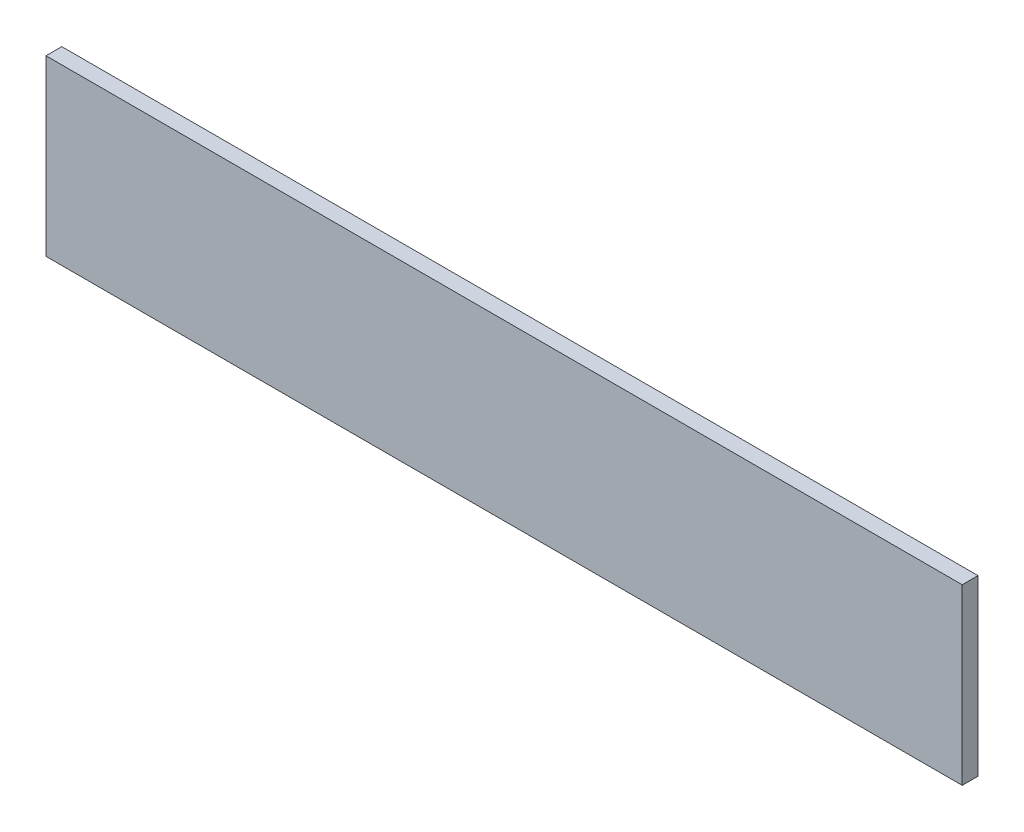
from build123d import *

# Parameters (mm, degrees)
ESQUISSE1_W        = 580
ESQUISSE1_H        = 110
BOSS_EXTRU_1_DEPTH = 10


with BuildPart() as part:
    # Esquisse1 → Boss.-Extru.1 (new body)
    with BuildSketch(Plane.XY):
        with Locations((290, 55)):
            Rectangle(ESQUISSE1_W, ESQUISSE1_H)
    extrude(amount=BOSS_EXTRU_1_DEPTH)


solid = part.part
